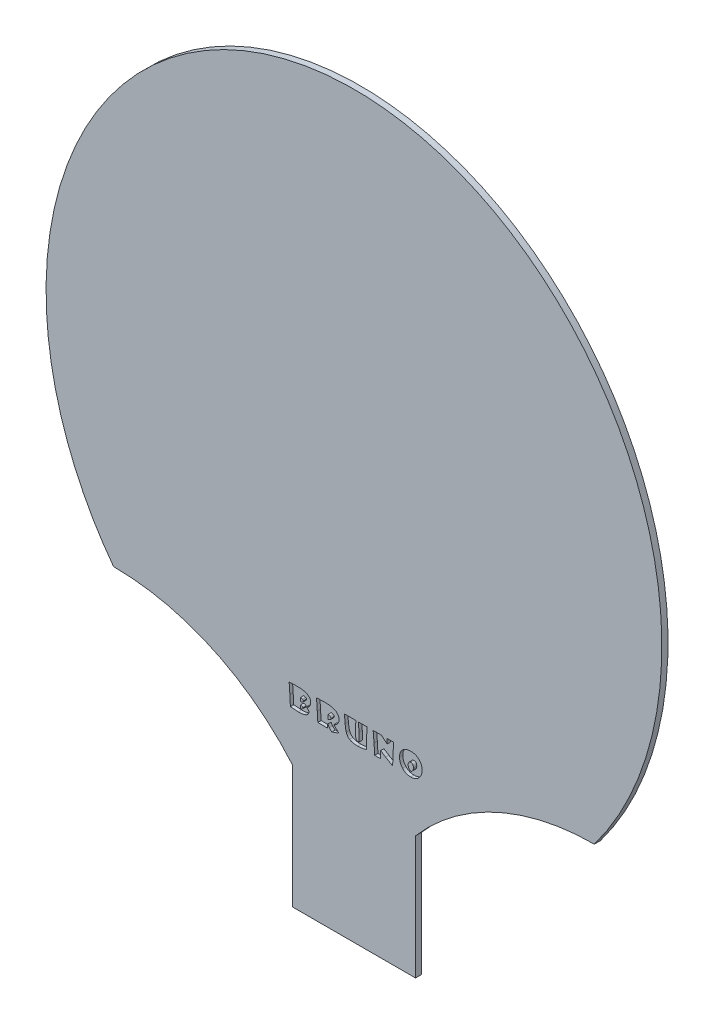
from build123d import *

# Parameters (mm, degrees)
ESBO_O1_W                = 30
ESBO_O1_H                = 30
RESSALTO_EXTRUS_O1_DEPTH = 1.5
CORTE_START              = -0.8
CORTE_BRUNO_1_DEPTH      = 0.8


# Read off the part's stored shape, not the designer's step: Corte Bruno 1
with BuildPart() as part:
    # Esboço1 → Ressalto-extrusão1 (new body)
    with BuildSketch(Plane.XY):
        with BuildLine():
            Line((-58.546856235, -50), (58.546856235, -50))
            add(Edge.make_bspline(
                [(58.546856235, -50), (156.12494996, 80), (0, 80), (-156.12494996, 80), (-58.546856235, -50)],
                knots=[4.037257447, 4.037257447, 4.037257447, 6.283185307, 6.283185307, 8.529113167, 8.529113167, 8.529113167], degree=2, weights=[1, 0.433012702, 1, 0.433012702, 1]))
        make_face()
        with Locations((0, -85)):
            Rectangle(ESBO_O1_W, ESBO_O1_H)
        with BuildLine():
            ThreePointArc((58.546856235, -50), (34.586844299, -55.23905744), (15, -70))
            Line((15, -70), (-15, -70))
            ThreePointArc((-15, -70), (-34.586844299, -55.23905744), (-58.546856235, -50))
            Line((-58.546856235, -50), (58.546856235, -50))
        make_face()
    extrude(amount=RESSALTO_EXTRUS_O1_DEPTH)

    # Corte Bruno 1 outline → Corte Bruno 1 (cut)
    # profile 1 of 5: a face of its own
    with BuildSketch(Plane.XY.offset(1.5).offset(CORTE_START)):
        with BuildLine():
            add(Edge.make_bspline(
                [(-13.84992284, -52.87654321), (-13.78208332, -52.876983521), (-13.648959534, -52.87784756), (-13.452157206, -52.882587587), (-13.262087736, -52.891023882), (-13.078202191, -52.903967336), (-12.900932607, -52.918842372), (-12.730237673, -52.938478289), (-12.565820729, -52.960369261), (-12.407843029, -52.98619911), (-12.256176636, -53.016508977), (-12.110880492, -53.048634563), (-11.972244267, -53.085496743), (-11.840218632, -53.126291311), (-11.713981082, -53.168847867), (-11.594979565, -53.216831681), (-11.481728101, -53.266662452), (-11.375132551, -53.32037367), (-11.275016955, -53.377692272), (-11.181296872, -53.438106746), (-11.094551522, -53.503233462), (-11.01304724, -53.570411353), (-10.93857607, -53.641989439), (-10.871080641, -53.717269742), (-10.809907242, -53.795946467), (-10.754869835, -53.877681226), (-10.706598948, -53.963297526), (-10.663401595, -54.051750881), (-10.629815113, -54.145080357), (-10.598619213, -54.240437599), (-10.577423487, -54.34014508), (-10.560554106, -54.442748054), (-10.550801475, -54.549128169), (-10.549860645, -54.621315776), (-10.549382716, -54.657986111)],
                knots=[0, 0, 0, 0, 0.048486167, 0.095146048, 0.140689849, 0.18445049, 0.226889914, 0.267820135, 0.307238957, 0.345430485, 0.382202775, 0.417768536, 0.451767723, 0.48469396, 0.516521869, 0.546945206, 0.576365371, 0.604933283, 0.632208699, 0.658786038, 0.684567735, 0.709692896, 0.734232273, 0.758314472, 0.781893727, 0.8054102, 0.828667038, 0.85210029, 0.875659383, 0.899496975, 0.923747408, 0.948415545, 0.97379579, 1, 1, 1, 1], degree=3))
            add(Edge.make_bspline(
                [(-15.796296296, -52.944058642), (-15.726536222, -52.938840423), (-15.583840166, -52.92816642), (-15.364950447, -52.913229121), (-15.135977451, -52.902200941), (-14.89743703, -52.892093831), (-14.649184653, -52.886174232), (-14.391362669, -52.879629247), (-14.123847283, -52.877181271), (-13.94219394, -52.87675814), (-13.84992284, -52.87654321)],
                knots=[0, 0, 0, 0, 0.107729629, 0.220363774, 0.337854188, 0.460740231, 0.588029638, 0.720256288, 0.857903743, 1, 1, 1, 1], degree=3))
            add(Edge.make_bspline(
                [(-15.608217593, -55.5), (-15.613561644, -55.420258829), (-15.624747537, -55.253348722), (-15.64482028, -54.991426575), (-15.664580635, -54.706517291), (-15.686565673, -54.398478921), (-15.712389704, -54.067756788), (-15.737571741, -53.713670399), (-15.767309339, -53.336657337), (-15.786444536, -53.07749066), (-15.796296296, -52.944058642)],
                knots=[0, 0, 0, 0, 0.093551319, 0.195816799, 0.307493408, 0.427857479, 0.55731239, 0.695802409, 0.843383806, 1, 1, 1, 1], degree=3))
            add(Edge.make_bspline(
                [(-15.485725309, -57.993248457), (-15.488569782, -57.921872956), (-15.494630749, -57.769786969), (-15.505343813, -57.527699133), (-15.517880709, -57.257958254), (-15.532359372, -56.960247124), (-15.549091142, -56.634919858), (-15.565853634, -56.281204636), (-15.586519195, -55.899939751), (-15.600821844, -55.63631669), (-15.608217593, -55.5)],
                knots=[0, 0, 0, 0, 0.085846366, 0.182920321, 0.291222691, 0.410368148, 0.541128977, 0.682714227, 0.835934891, 1, 1, 1, 1], degree=3))
            add(Edge.make_bspline(
                [(-13.54996142, -58.12345679), (-13.700460559, -58.122067851), (-14.009053283, -58.119219885), (-14.482443003, -58.091919335), (-14.977548228, -58.052503013), (-15.313828368, -58.013292015), (-15.485725309, -57.993248457)],
                knots=[0, 0, 0, 0, 0.23255558, 0.476846316, 0.732578565, 1, 1, 1, 1], degree=3))
            add(Edge.make_bspline(
                [(-11.871720679, -57.895833333), (-11.926499008, -57.914175772), (-12.039266979, -57.951935953), (-12.217295866, -57.997289844), (-12.407699068, -58.037261983), (-12.611287786, -58.068260587), (-12.827747527, -58.093689277), (-13.057212272, -58.110299303), (-13.299405775, -58.121200108), (-13.46507222, -58.122692218), (-13.54996142, -58.12345679)],
                knots=[0, 0, 0, 0, 0.101828071, 0.209625688, 0.323695004, 0.444761783, 0.572596546, 0.707900484, 0.850325188, 1, 1, 1, 1], degree=3))
            add(Edge.make_bspline(
                [(-10.981481481, -56.92650463), (-10.982367698, -56.953214497), (-10.984113749, -57.005839088), (-10.993645683, -57.083757453), (-11.010844066, -57.159174165), (-11.036526025, -57.231440793), (-11.067265469, -57.301899538), (-11.106111406, -57.369206466), (-11.151612857, -57.434090531), (-11.203989149, -57.495977139), (-11.263405735, -57.555276294), (-11.329840679, -57.611568618), (-11.402553825, -57.666327502), (-11.483097904, -57.716855342), (-11.569919916, -57.766570001), (-11.664319957, -57.812170147), (-11.765312974, -57.856075594), (-11.835583477, -57.882331177), (-11.871720679, -57.895833333)],
                knots=[0, 0, 0, 0, 0.056793551, 0.111896375, 0.166607851, 0.220860621, 0.27471153, 0.329814354, 0.385750141, 0.442982037, 0.501942653, 0.563991467, 0.62796407, 0.695270766, 0.765972385, 0.840554826, 0.918003967, 1, 1, 1, 1], degree=3))
            add(Edge.make_bspline(
                [(-11.599729938, -56.138503086), (-11.559235224, -56.150095557), (-11.477511736, -56.173490639), (-11.364152321, -56.239033627), (-11.259252588, -56.326298897), (-11.164994566, -56.432781743), (-11.085656904, -56.550650977), (-11.024827718, -56.673323417), (-10.988458924, -56.799377414), (-10.983787417, -56.884491082), (-10.981481481, -56.92650463)],
                knots=[0, 0, 0, 0, 0.11779373, 0.237722745, 0.363944042, 0.499365142, 0.635197097, 0.761457057, 0.882251166, 1, 1, 1, 1], degree=3))
            add(Edge.make_bspline(
                [(-10.915895062, -55.683256173), (-10.939932348, -55.711273333), (-10.987517431, -55.76673712), (-11.06488756, -55.842458313), (-11.144652973, -55.911896778), (-11.229727259, -55.971092723), (-11.315946641, -56.026170601), (-11.407374621, -56.071283359), (-11.501975636, -56.109110873), (-11.567096609, -56.128691081), (-11.599729938, -56.138503086)],
                knots=[0, 0, 0, 0, 0.132562368, 0.262425271, 0.388583219, 0.511977292, 0.63441079, 0.755799208, 0.877626448, 1, 1, 1, 1], degree=3))
            add(Edge.make_bspline(
                [(-10.549382716, -54.657986111), (-10.550444529, -54.70530682), (-10.552546547, -54.798985248), (-10.570798413, -54.936974393), (-10.598181098, -55.071517488), (-10.639488358, -55.201523284), (-10.690130605, -55.32892002), (-10.754764738, -55.451162127), (-10.82861733, -55.570862893), (-10.886573173, -55.645496446), (-10.915895062, -55.683256173)],
                knots=[0, 0, 0, 0, 0.127732324, 0.252865258, 0.375294402, 0.498043286, 0.620733818, 0.744996294, 0.870984699, 1, 1, 1, 1], degree=3))
        make_face()
        with BuildLine():
            add(Edge.make_bspline(
                [(-13.08121142, -57.140625), (-13.032953208, -57.141329709), (-12.942630318, -57.142648684), (-12.816042373, -57.129331333), (-12.707804238, -57.104839986), (-12.618191796, -57.065397394), (-12.548002597, -57.011342041), (-12.497848743, -56.943272615), (-12.467593365, -56.861670572), (-12.464557324, -56.80299619), (-12.462962963, -56.772183642)],
                knots=[0, 0, 0, 0, 0.17663686, 0.330603872, 0.465123508, 0.58158224, 0.686410906, 0.785800836, 0.887514417, 1, 1, 1, 1], degree=3))
            Line((-13.08121142, -57.140625), (-13.071618094, -56.456620844))
            add(Edge.make_bspline(
                [(-13.054205247, -56.456790123), (-13.058794525, -56.456630156), (-13.063383804, -56.456470189), (-13.071618094, -56.456620844)],
                knots=[0, 0, 0, 0, 0.369686737, 0.369686737, 0.369686737, 0.369686737], degree=3))
            add(Edge.make_bspline(
                [(-12.462962963, -56.772183642), (-12.464769003, -56.747157461), (-12.46824262, -56.699023752), (-12.49679066, -56.631602602), (-12.545610744, -56.576131374), (-12.6126373, -56.531499444), (-12.697641199, -56.497217469), (-12.800347161, -56.473030212), (-12.921366465, -56.459090332), (-13.007869363, -56.457592466), (-13.054205247, -56.456790123)],
                knots=[0, 0, 0, 0, 0.100094707, 0.192515572, 0.287595298, 0.392362388, 0.512546851, 0.653242547, 0.814256936, 1, 1, 1, 1], degree=3))
        make_face(mode=Mode.SUBTRACT)
        with BuildLine():
            add(Edge.make_bspline(
                [(-13.04841821, -55.659143519), (-12.993086587, -55.659576096), (-12.889230184, -55.660388036), (-12.744202583, -55.645597208), (-12.620743996, -55.617697242), (-12.518568652, -55.575664229), (-12.437395813, -55.518551853), (-12.380207906, -55.444897733), (-12.344110397, -55.357435895), (-12.341086167, -55.293963387), (-12.339506173, -55.260802469)],
                knots=[0, 0, 0, 0, 0.180384303, 0.338577899, 0.474404598, 0.591860886, 0.696948382, 0.794074037, 0.892414934, 1, 1, 1, 1], degree=3))
            Line((-13.04841821, -55.659143519), (-13.022376543, -54.84992284))
            add(Edge.make_bspline(
                [(-12.562307099, -54.954089506), (-12.598935587, -54.937457227), (-12.671629171, -54.904448494), (-12.785982743, -54.870741639), (-12.903410493, -54.851843062), (-12.982441671, -54.850567426), (-13.022376543, -54.84992284)],
                knots=[0, 0, 0, 0, 0.253208097, 0.50252152, 0.748621495, 1, 1, 1, 1], degree=3))
            add(Edge.make_bspline(
                [(-12.339506173, -55.260802469), (-12.340386558, -55.244686802), (-12.342110336, -55.213132642), (-12.351591741, -55.16699703), (-12.3692282, -55.123821467), (-12.394907931, -55.084393096), (-12.426373647, -55.046838519), (-12.46489794, -55.012281924), (-12.51110977, -54.981384649), (-12.544776449, -54.963435728), (-12.562307099, -54.954089506)],
                knots=[0, 0, 0, 0, 0.120452694, 0.23584402, 0.350004404, 0.466588951, 0.58588712, 0.715116267, 0.851657572, 1, 1, 1, 1], degree=3))
        make_face(mode=Mode.SUBTRACT)
    # profile 2 of 5: a face of its own
    with BuildSketch(Plane.XY.offset(1.5).offset(CORTE_START)):
        with BuildLine():
            add(Edge.make_bspline(
                [(15.787615741, -53.424382716), (15.820795875, -53.455176157), (15.886660933, -53.516303451), (15.978144747, -53.614464317), (16.064262288, -53.715467045), (16.14348088, -53.820802802), (16.215927143, -53.930186503), (16.282221866, -54.043044989), (16.343765584, -54.159087023), (16.397340682, -54.279477031), (16.444652606, -54.403539608), (16.486552905, -54.531145067), (16.520937903, -54.662956299), (16.548840604, -54.798555123), (16.570977024, -54.937593618), (16.587428087, -55.080119196), (16.597374785, -55.226579464), (16.598297183, -55.325408746), (16.598765432, -55.375578704)],
                knots=[0, 0, 0, 0, 0.06228022, 0.123630915, 0.184533228, 0.244884976, 0.304893523, 0.364993348, 0.424961101, 0.485565341, 0.546208333, 0.607633971, 0.670309008, 0.733568557, 0.798090541, 0.864005354, 0.930963318, 1, 1, 1, 1], degree=3))
            add(Edge.make_bspline(
                [(13.830632716, -52.75308642), (13.929407731, -52.755154433), (14.122633477, -52.759199923), (14.405102727, -52.789894245), (14.672441022, -52.843282551), (14.925550221, -52.916111963), (15.163792642, -53.011151618), (15.38811982, -53.126218868), (15.597827365, -53.262878798), (15.724392642, -53.370581855), (15.787615741, -53.424382716)],
                knots=[0, 0, 0, 0, 0.139929551, 0.273733109, 0.401924186, 0.525748481, 0.64636684, 0.764729608, 0.882475482, 1, 1, 1, 1], degree=3))
            add(Edge.make_bspline(
                [(11.893904321, -53.420524691), (11.957171583, -53.367093681), (12.083434764, -53.260460816), (12.291682911, -53.124446096), (12.513576323, -53.008910406), (12.750146369, -52.915706205), (13.000193712, -52.841879248), (13.264657694, -52.790355477), (13.543099634, -52.759113913), (13.733456233, -52.755123509), (13.830632716, -52.75308642)],
                knots=[0, 0, 0, 0, 0.118415536, 0.236323208, 0.355058288, 0.475863813, 0.59960796, 0.727643961, 0.860963044, 1, 1, 1, 1], degree=3))
            add(Edge.make_bspline(
                [(11.104938272, -55.375578704), (11.105396412, -55.324443308), (11.106302015, -55.223364194), (11.116426201, -55.074066533), (11.13179349, -54.928952233), (11.152666337, -54.787856897), (11.18086327, -54.651152795), (11.214368808, -54.518355678), (11.255156053, -54.39005304), (11.301503145, -54.265488459), (11.353169196, -54.144681038), (11.412526356, -54.028784623), (11.477230785, -53.916763517), (11.547326443, -53.808356849), (11.625080176, -53.705221822), (11.708118517, -53.605454854), (11.797485919, -53.509918139), (11.861710881, -53.450372548), (11.893904321, -53.420524691)],
                knots=[0, 0, 0, 0, 0.070527055, 0.139410522, 0.206311012, 0.271791149, 0.336066237, 0.398775425, 0.4606304, 0.521672383, 0.582060003, 0.64175974, 0.701168853, 0.760458663, 0.819708653, 0.879217002, 0.939456247, 1, 1, 1, 1], degree=3))
            add(Edge.make_bspline(
                [(11.825424383, -57.336419753), (11.767783615, -57.269013725), (11.653367568, -57.135213784), (11.507093572, -56.916844239), (11.382616989, -56.687961857), (11.281122311, -56.447551681), (11.201482999, -56.195770281), (11.14622429, -55.932105563), (11.111513926, -55.657497349), (11.107152898, -55.470526586), (11.104938272, -55.375578704)],
                knots=[0, 0, 0, 0, 0.124336901, 0.246806856, 0.367899504, 0.489368721, 0.612331856, 0.737771534, 0.866834594, 1, 1, 1, 1], degree=3))
            add(Edge.make_bspline(
                [(13.830632716, -58.185185185), (13.779812526, -58.184817923), (13.679020706, -58.18408953), (13.529762827, -58.172543289), (13.383890875, -58.156715771), (13.241923267, -58.133475135), (13.103486656, -58.10355166), (12.969026137, -58.066854144), (12.837656869, -58.024640016), (12.710871858, -57.97402647), (12.586483474, -57.918303338), (12.466624503, -57.854647976), (12.350135684, -57.784709938), (12.237355674, -57.708957539), (12.128918098, -57.625312803), (12.02416452, -57.535311493), (11.920923413, -57.440569921), (11.857409414, -57.371302269), (11.825424383, -57.336419753)],
                knots=[0, 0, 0, 0, 0.067845533, 0.134558231, 0.199795815, 0.263742144, 0.326561609, 0.388841816, 0.449801392, 0.510711057, 0.571043021, 0.631729859, 0.691810783, 0.752420123, 0.813044666, 0.874559574, 0.936829422, 1, 1, 1, 1], degree=3))
            add(Edge.make_bspline(
                [(15.84837963, -57.343171296), (15.815911097, -57.37756772), (15.751590546, -57.445707447), (15.649915481, -57.541805321), (15.543790328, -57.630052953), (15.434665882, -57.712621404), (15.321300796, -57.787762044), (15.204733154, -57.857492343), (15.083921441, -57.920209281), (14.959306292, -57.976243324), (14.831086121, -58.025352028), (14.698998822, -58.067815985), (14.563686092, -58.104811485), (14.424023757, -58.133147615), (14.281248552, -58.156807951), (14.134389019, -58.172517059), (13.983853127, -58.184119423), (13.882096468, -58.184827216), (13.830632716, -58.185185185)],
                knots=[0, 0, 0, 0, 0.06292556, 0.124656286, 0.185997485, 0.246482571, 0.306632448, 0.366861365, 0.427128246, 0.487629968, 0.548561133, 0.60970514, 0.672171037, 0.735090781, 0.799226004, 0.864650656, 0.93154664, 1, 1, 1, 1], degree=3))
            add(Edge.make_bspline(
                [(16.598765432, -55.375578704), (16.596733857, -55.469583451), (16.592732028, -55.654755561), (16.555331687, -55.926721216), (16.498257107, -56.18886564), (16.415753414, -56.440870584), (16.309046674, -56.682942696), (16.179168548, -56.915024024), (16.026858189, -57.137605588), (15.908278038, -57.274182288), (15.84837963, -57.343171296)],
                knots=[0, 0, 0, 0, 0.13070011, 0.257455244, 0.38115174, 0.503486546, 0.625637283, 0.74856821, 0.872994222, 1, 1, 1, 1], degree=3))
        make_face()
        with BuildLine():
            add(Edge.make_bspline(
                [(14.293595679, -56.613040123), (14.325405895, -56.560157307), (14.387392789, -56.457107345), (14.452030551, -56.291769463), (14.492918768, -56.124432494), (14.497649043, -56.011416234), (14.5, -55.955246914)],
                knots=[0, 0, 0, 0, 0.264506915, 0.515430717, 0.759168042, 1, 1, 1, 1], degree=3))
            add(Edge.make_bspline(
                [(13.802662037, -56.950617284), (13.825289821, -56.949888831), (13.870517805, -56.948432814), (13.936810107, -56.930265489), (14.002212351, -56.90507798), (14.064070079, -56.865729254), (14.125388374, -56.818561693), (14.184160257, -56.759887671), (14.241382286, -56.691144964), (14.275741257, -56.639748152), (14.293595679, -56.613040123)],
                knots=[0, 0, 0, 0, 0.108802247, 0.217471863, 0.329463808, 0.445658679, 0.56939707, 0.702050949, 0.845172658, 1, 1, 1, 1], degree=3))
            add(Edge.make_bspline(
                [(13.376350309, -56.621720679), (13.392712879, -56.647678208), (13.423892109, -56.697140839), (13.474363783, -56.764639245), (13.526157082, -56.821758623), (13.579234181, -56.86838166), (13.633142357, -56.905195805), (13.68831241, -56.931529759), (13.745135042, -56.948002341), (13.783588908, -56.949750297), (13.802662037, -56.950617284)],
                knots=[0, 0, 0, 0, 0.163512425, 0.311576446, 0.448640259, 0.573740312, 0.687336736, 0.795422133, 0.898529316, 1, 1, 1, 1], degree=3))
            add(Edge.make_bspline(
                [(13.203703704, -55.961998457), (13.205515346, -56.022298111), (13.209060592, -56.140299919), (13.243587235, -56.311660728), (13.296222138, -56.473812498), (13.349726426, -56.57257579), (13.376350309, -56.621720679)],
                knots=[0, 0, 0, 0, 0.26188506, 0.512489014, 0.757413178, 1, 1, 1, 1], degree=3))
            add(Edge.make_bspline(
                [(13.811342593, -55.098765432), (13.786858555, -55.099113841), (13.738928233, -55.099795892), (13.669894501, -55.111115461), (13.604839464, -55.126975418), (13.545479294, -55.151359956), (13.489970557, -55.181491621), (13.440312659, -55.219528967), (13.393781488, -55.262873251), (13.354971994, -55.31509796), (13.318355368, -55.372259929), (13.288105585, -55.437023998), (13.262169339, -55.508131737), (13.239456029, -55.585577724), (13.223787542, -55.670304659), (13.212495057, -55.7617925), (13.204203088, -55.859611198), (13.203873148, -55.927257731), (13.203703704, -55.961998457)],
                knots=[0, 0, 0, 0, 0.061107874, 0.1196257, 0.174382537, 0.228091982, 0.279517476, 0.331740119, 0.384018354, 0.437853843, 0.493805939, 0.553459928, 0.615993052, 0.682870666, 0.754879268, 0.831014146, 0.913215193, 1, 1, 1, 1], degree=3))
            add(Edge.make_bspline(
                [(14.5, -55.955246914), (14.499400876, -55.920510948), (14.49824545, -55.853521734), (14.490626717, -55.756200964), (14.477381848, -55.665582367), (14.458264877, -55.581721214), (14.433743939, -55.504784133), (14.405657268, -55.43358598), (14.369195228, -55.37041462), (14.330008563, -55.312003794), (14.283150878, -55.262098187), (14.23182394, -55.218215006), (14.174771351, -55.180978207), (14.112650205, -55.150413568), (14.044613869, -55.126768799), (13.971343015, -55.111259039), (13.893040859, -55.099743981), (13.839037596, -55.099097152), (13.811342593, -55.098765432)],
                knots=[0, 0, 0, 0, 0.082931877, 0.159936282, 0.232885765, 0.301408102, 0.365011769, 0.425593185, 0.483672034, 0.538821238, 0.59314157, 0.646509896, 0.699734505, 0.755346508, 0.811422744, 0.871201333, 0.933946964, 1, 1, 1, 1], degree=3))
        make_face(mode=Mode.SUBTRACT)
    # profile 3 of 5: a face of its own
    with BuildSketch(Plane.XY.offset(1.5).offset(CORTE_START)):
        with BuildLine():
            add(Edge.make_bspline(
                [(9.672839506, -52.938271605), (9.668038212, -53.00257345), (9.657739748, -53.140496731), (9.64078228, -53.36128478), (9.625114313, -53.61054493), (9.606685942, -53.887671956), (9.586158324, -54.193060389), (9.565060931, -54.526788627), (9.542923611, -54.888803498), (9.528116476, -55.139593369), (9.520447531, -55.269483025)],
                knots=[0, 0, 0, 0, 0.082801871, 0.177604637, 0.284350875, 0.403510097, 0.53425841, 0.677392921, 0.832914614, 1, 1, 1, 1], degree=3))
            Line((9.672839506, -52.938271605), (8.005208333, -52.938271605))
            add(Edge.make_bspline(
                [(8.052469136, -53.544945988), (8.049885443, -53.507009723), (8.044148414, -53.422773146), (8.034969961, -53.283799336), (8.020871626, -53.119577745), (8.010679921, -53.001606467), (8.005208333, -52.938271605)],
                knots=[0, 0, 0, 0, 0.18745622, 0.416242101, 0.686599767, 1, 1, 1, 1], degree=3))
            add(Edge.make_bspline(
                [(8.067901235, -54.111111111), (8.067738047, -54.057097024), (8.067425246, -53.953561506), (8.0644722, -53.805013899), (8.060025763, -53.670263868), (8.054891939, -53.585125357), (8.052469136, -53.544945988)],
                knots=[0, 0, 0, 0, 0.28605147, 0.54831042, 0.786834396, 1, 1, 1, 1], degree=3))
            Line((8.067901235, -54.111111111), (6.706018519, -52.938271605))
            Line((6.706018519, -52.938271605), (4.672839506, -52.938271605))
            add(Edge.make_bspline(
                [(4.887924383, -55.480709877), (4.878868397, -55.360793753), (4.861047952, -55.124821774), (4.835698579, -54.776853324), (4.808246656, -54.440940976), (4.781425581, -54.117172149), (4.754350603, -53.805319054), (4.727420632, -53.50567061), (4.700444507, -53.217920737), (4.681915418, -53.030214039), (4.672839506, -52.938271605)],
                knots=[0, 0, 0, 0, 0.141391042, 0.278230509, 0.410199938, 0.537648486, 0.660200676, 0.778234453, 0.891374872, 1, 1, 1, 1], degree=3))
            add(Edge.make_bspline(
                [(5.046103395, -58), (5.044541262, -57.969133334), (5.041253851, -57.904176377), (5.035168268, -57.802615499), (5.029716706, -57.692304442), (5.022818787, -57.57367729), (5.015198788, -57.446355979), (5.006175151, -57.310401808), (4.997840949, -57.165684761), (4.988154185, -57.012329977), (4.977259043, -56.850653497), (4.967017657, -56.680213322), (4.954991659, -56.501507484), (4.944127391, -56.3136627), (4.929879317, -56.117637688), (4.916891496, -55.912785046), (4.90199501, -55.699679201), (4.892676305, -55.554660051), (4.887924383, -55.480709877)],
                knots=[0, 0, 0, 0, 0.036730575, 0.077297186, 0.120915992, 0.167989387, 0.218518109, 0.272502756, 0.329919667, 0.390792372, 0.455121324, 0.522500778, 0.593717691, 0.667985261, 0.746115421, 0.827295416, 0.911932086, 1, 1, 1, 1], degree=3))
            Line((5.046103395, -58), (6.460069444, -58))
            Line((6.460069444, -58), (6.497685185, -56.271604938))
            add(Edge.make_bspline(
                [(7.705246914, -57.054783951), (7.665586407, -57.03182928), (7.58282949, -56.983931311), (7.45580197, -56.905090848), (7.318454072, -56.8195332), (7.172681741, -56.724843194), (7.01660588, -56.623635958), (6.852113149, -56.513334344), (6.677296546, -56.396163843), (6.558656988, -56.313888349), (6.497685185, -56.271604938)],
                knots=[0, 0, 0, 0, 0.095485285, 0.199242732, 0.311518653, 0.432683436, 0.561458902, 0.699146855, 0.845384129, 1, 1, 1, 1], degree=3))
            add(Edge.make_bspline(
                [(9.420138889, -58.061728395), (9.365691938, -58.032354449), (9.251439129, -57.970715444), (9.074634773, -57.869835625), (8.882192773, -57.759881154), (8.675080113, -57.63941562), (8.453236292, -57.508242447), (8.217262159, -57.366226766), (7.965739132, -57.214860555), (7.793895166, -57.109259709), (7.705246914, -57.054783951)],
                knots=[0, 0, 0, 0, 0.093312683, 0.195809609, 0.307027237, 0.427631593, 0.557209237, 0.695766304, 0.843056546, 1, 1, 1, 1], degree=3))
            add(Edge.make_bspline(
                [(9.520447531, -55.269483025), (9.515494982, -55.3704288), (9.505370258, -55.576796907), (9.492351409, -55.893191873), (9.478412803, -56.222702376), (9.466374358, -56.565134202), (9.453328774, -56.920687901), (9.442290323, -57.289479586), (9.430273013, -57.671402017), (9.423552995, -57.930230523), (9.420138889, -58.061728395)],
                knots=[0, 0, 0, 0, 0.108514277, 0.221840744, 0.339995699, 0.462621431, 0.589731775, 0.722005656, 0.85876492, 1, 1, 1, 1], degree=3))
        make_face()
    # profile 4 of 5: a face of its own
    with BuildSketch(Plane.XY.offset(1.5).offset(CORTE_START)):
        with BuildLine():
            add(Edge.make_bspline(
                [(3.091242284, -55.073688272), (3.090030598, -55.110020881), (3.087521147, -55.185267148), (3.082130432, -55.302248028), (3.078361284, -55.427324487), (3.07609134, -55.560457036), (3.071555835, -55.70156425), (3.068751222, -55.850749852), (3.067473041, -56.00798286), (3.06377513, -56.173214236), (3.062459027, -56.346838201), (3.059958923, -56.528800595), (3.059799781, -56.718819747), (3.057160109, -56.916532903), (3.056260106, -57.122298606), (3.056901759, -57.336099627), (3.055198445, -57.558254738), (3.055435006, -57.70904039), (3.055555556, -57.78587963)],
                knots=[0, 0, 0, 0, 0.040203956, 0.083263979, 0.129509243, 0.17858874, 0.23052064, 0.285643463, 0.343604843, 0.404415732, 0.468421297, 0.535626754, 0.605673868, 0.678568064, 0.754304142, 0.833239466, 0.915020079, 1, 1, 1, 1], degree=3))
            Line((3.091242284, -55.073688272), (3.179012346, -52.938271605))
            Line((3.179012346, -52.938271605), (1.080246914, -52.938271605))
            add(Edge.make_bspline(
                [(1.220100309, -55.020640432), (1.216618968, -54.956979881), (1.209303738, -54.823212013), (1.196633501, -54.612634278), (1.18215126, -54.382117579), (1.165789561, -54.131664113), (1.147298928, -53.861291972), (1.127468293, -53.57124215), (1.103605437, -53.261412996), (1.088195473, -53.048231833), (1.080246914, -52.938271605)],
                knots=[0, 0, 0, 0, 0.091642466, 0.192565366, 0.303231302, 0.423641177, 0.553334618, 0.692773308, 0.841530478, 1, 1, 1, 1], degree=3))
            add(Edge.make_bspline(
                [(1.265432099, -57.091435185), (1.265144958, -57.035172196), (1.264528003, -56.914285002), (1.262772409, -56.720087955), (1.258515045, -56.500189498), (1.253734723, -56.254240053), (1.248130174, -55.982236681), (1.240355098, -55.684523864), (1.230423017, -55.36111002), (1.223628958, -55.137024398), (1.220100309, -55.020640432)],
                knots=[0, 0, 0, 0, 0.081488378, 0.175086705, 0.281269023, 0.400030115, 0.531370389, 0.675301446, 0.831360419, 1, 1, 1, 1], degree=3))
            add(Edge.make_bspline(
                [(1.036844136, -57.135802469), (1.076093752, -57.133734086), (1.154362677, -57.129609457), (1.228481657, -57.104134956), (1.265432099, -57.091435185)],
                knots=[0, 0, 0, 0, 0.501471251, 1, 1, 1, 1], degree=3))
            add(Edge.make_bspline(
                [(0.533371914, -56.890817901), (0.545208579, -56.91062796), (0.568516859, -56.94963712), (0.615548106, -56.998890992), (0.667378695, -57.042155911), (0.727839303, -57.075954358), (0.794799502, -57.103245957), (0.869467819, -57.122043556), (0.950950107, -57.133811323), (1.007544257, -57.135123256), (1.036844136, -57.135802469)],
                knots=[0, 0, 0, 0, 0.117148244, 0.23068355, 0.344713463, 0.459842654, 0.581744188, 0.711978657, 0.850885821, 1, 1, 1, 1], degree=3))
            add(Edge.make_bspline(
                [(0.400270062, -55.908950617), (0.400781608, -55.969084929), (0.401755919, -56.083619077), (0.410202124, -56.247265631), (0.419947534, -56.394355474), (0.434541825, -56.525286267), (0.451765537, -56.640230644), (0.475385416, -56.738542257), (0.499713314, -56.821733466), (0.522831819, -56.869184306), (0.533371914, -56.890817901)],
                knots=[0, 0, 0, 0, 0.180760737, 0.344283932, 0.492541742, 0.623823626, 0.74029517, 0.841571461, 0.927769902, 1, 1, 1, 1], degree=3))
            add(Edge.make_bspline(
                [(0.391589506, -54.391782407), (0.390445864, -54.438397906), (0.388040516, -54.536441196), (0.387996435, -54.690459962), (0.386128045, -54.858924154), (0.388076373, -55.041537109), (0.3881927, -55.238307199), (0.391683415, -55.449207317), (0.395350541, -55.674261594), (0.398598742, -55.829219188), (0.400270062, -55.908950617)],
                knots=[0, 0, 0, 0, 0.092191639, 0.193900564, 0.304508687, 0.425287349, 0.554965254, 0.69355408, 0.842322208, 1, 1, 1, 1], degree=3))
            add(Edge.make_bspline(
                [(0.462962963, -52.938271605), (0.459916819, -52.981665273), (0.453488768, -53.07323571), (0.446544046, -53.218316864), (0.437347494, -53.377736633), (0.429199658, -53.552034773), (0.418758117, -53.74100962), (0.410996496, -53.944914146), (0.400761302, -54.163495483), (0.394715543, -54.313975029), (0.391589506, -54.391782407)],
                knots=[0, 0, 0, 0, 0.089670421, 0.189224836, 0.299403609, 0.418848389, 0.548917169, 0.689547611, 0.839476613, 1, 1, 1, 1], degree=3))
            Line((0.462962963, -52.938271605), (-2.314814815, -52.938271605))
            add(Edge.make_bspline(
                [(-2.159529321, -54.953125), (-2.179221551, -54.778945177), (-2.218096081, -54.435095917), (-2.263123907, -53.924752793), (-2.296849466, -53.427292369), (-2.308884125, -53.0997063), (-2.314814815, -52.938271605)],
                knots=[0, 0, 0, 0, 0.260134774, 0.513533358, 0.760268823, 1, 1, 1, 1], degree=3))
            add(Edge.make_bspline(
                [(-1.880787037, -56.550347222), (-1.893432319, -56.509958477), (-1.92082904, -56.422453972), (-1.95545309, -56.277906321), (-1.990820833, -56.111586018), (-2.026701269, -55.922897619), (-2.060959797, -55.712184574), (-2.094440514, -55.478983991), (-2.128437985, -55.223759367), (-2.148887903, -55.045753164), (-2.159529321, -54.953125)],
                knots=[0, 0, 0, 0, 0.07818343, 0.169388834, 0.274487952, 0.392399358, 0.524247725, 0.668921594, 0.827718448, 1, 1, 1, 1], degree=3))
            add(Edge.make_bspline(
                [(-1.059992284, -57.694251543), (-1.107306906, -57.662391367), (-1.201749106, -57.598796965), (-1.331062, -57.486553053), (-1.450647003, -57.362635439), (-1.55865688, -57.224958691), (-1.656295647, -57.074802683), (-1.743259812, -56.912274502), (-1.818884567, -56.73654772), (-1.859834131, -56.613372843), (-1.880787037, -56.550347222)],
                knots=[0, 0, 0, 0, 0.118866889, 0.237263871, 0.356289501, 0.47755091, 0.601594317, 0.729383016, 0.861531802, 1, 1, 1, 1], degree=3))
            add(Edge.make_bspline(
                [(0.908564815, -58.12345679), (0.804043967, -58.122232803), (0.601224892, -58.119857698), (0.306619105, -58.099527086), (0.031388182, -58.065857387), (-0.225118179, -58.020764366), (-0.462112261, -57.959445418), (-0.680773518, -57.887240119), (-0.880061356, -57.800013036), (-1.001130384, -57.728849944), (-1.059992284, -57.694251543)],
                knots=[0, 0, 0, 0, 0.153687137, 0.29822455, 0.433977344, 0.561301056, 0.680898824, 0.793625401, 0.899663844, 1, 1, 1, 1], degree=3))
            add(Edge.make_bspline(
                [(3.055555556, -57.78587963), (2.965405423, -57.812927637), (2.786293457, -57.866667122), (2.51590382, -57.93468659), (2.246396027, -57.993049009), (1.977293695, -58.039749038), (1.709167203, -58.078311655), (1.441648767, -58.103371168), (1.175011548, -58.121224679), (0.997329183, -58.122713182), (0.908564815, -58.12345679)],
                knots=[0, 0, 0, 0, 0.129417111, 0.257128331, 0.38329971, 0.508538878, 0.632651568, 0.755698968, 0.8779551, 1, 1, 1, 1], degree=3))
        make_face()
    # profile 5 of 5: a face of its own
    with BuildSketch(Plane.XY.offset(1.5).offset(CORTE_START)):
        with BuildLine():
            add(Edge.make_bspline(
                [(-7.071566358, -52.87654321), (-7.000832096, -52.876904209), (-6.861589874, -52.877614847), (-6.656104777, -52.883503468), (-6.457382167, -52.893162286), (-6.265315578, -52.906142332), (-6.080201015, -52.925098621), (-5.901618975, -52.94578874), (-5.7298997, -52.97103769), (-5.564706605, -52.999390334), (-5.406743232, -53.03387446), (-5.25481948, -53.069570031), (-5.110191392, -53.112034111), (-4.971206845, -53.155144631), (-4.840135561, -53.205232822), (-4.715027842, -53.256657718), (-4.597400175, -53.313800357), (-4.486549746, -53.374647654), (-4.381500558, -53.438362937), (-4.283442043, -53.506479576), (-4.192363131, -53.579105241), (-4.108265113, -53.655755015), (-4.029892088, -53.735296261), (-3.959262003, -53.819710399), (-3.895578921, -53.907970635), (-3.837272177, -53.999250105), (-3.787109557, -54.095293397), (-3.743946699, -54.19510493), (-3.705427995, -54.298398218), (-3.676676314, -54.406545044), (-3.651516379, -54.517661332), (-3.636106576, -54.633231365), (-3.624525253, -54.752271992), (-3.623815342, -54.833174419), (-3.62345679, -54.874035494)],
                knots=[0, 0, 0, 0, 0.04735022, 0.093210132, 0.137597532, 0.180532045, 0.222056002, 0.262152129, 0.300867697, 0.338232286, 0.374323107, 0.409088199, 0.442671389, 0.47520584, 0.506466038, 0.536563682, 0.56572968, 0.593950514, 0.621190861, 0.647937876, 0.673818846, 0.699110557, 0.724070439, 0.748512767, 0.772706527, 0.796888797, 0.820955867, 0.845146756, 0.86965721, 0.894668073, 0.919996386, 0.94586751, 0.972659514, 1, 1, 1, 1], degree=3))
            add(Edge.make_bspline(
                [(-9.117283951, -52.943094136), (-9.02148158, -52.937851253), (-8.833115677, -52.927542737), (-8.555012067, -52.914020191), (-8.285908427, -52.902543411), (-8.025831751, -52.892398966), (-7.774694324, -52.886395197), (-7.532629827, -52.879824761), (-7.299195857, -52.877213393), (-7.146476594, -52.876763759), (-7.071566358, -52.87654321)],
                knots=[0, 0, 0, 0, 0.140609385, 0.276465119, 0.408041671, 0.535343427, 0.6578907, 0.776186883, 0.890217559, 1, 1, 1, 1], degree=3))
            add(Edge.make_bspline(
                [(-8.941743827, -55.630208333), (-8.945586454, -55.547260303), (-8.953659512, -55.372992986), (-8.966673036, -55.099009782), (-8.984613499, -54.800378904), (-9.004407985, -54.476893608), (-9.029374165, -54.128806014), (-9.054646242, -53.755441257), (-9.085001578, -53.35747488), (-9.106313771, -53.083908789), (-9.117283951, -52.943094136)],
                knots=[0, 0, 0, 0, 0.092503851, 0.194343347, 0.305558362, 0.425775752, 0.555379325, 0.69432218, 0.842656245, 1, 1, 1, 1], degree=3))
            add(Edge.make_bspline(
                [(-8.804783951, -58), (-8.809332272, -57.932166149), (-8.81900983, -57.787834675), (-8.833376273, -57.558274557), (-8.848849304, -57.302039253), (-8.86522812, -57.019115488), (-8.882172161, -56.709467348), (-8.902238672, -56.37357667), (-8.920742621, -56.010843662), (-8.934577721, -55.760090078), (-8.941743827, -55.630208333)],
                knots=[0, 0, 0, 0, 0.085921888, 0.182817761, 0.290688465, 0.410345886, 0.540979288, 0.682611739, 0.835603782, 1, 1, 1, 1], degree=3))
            Line((-8.804783951, -58), (-6.404128086, -58))
            Line((-6.404128086, -58), (-6.384926587, -57.115194683))
            add(Edge.make_bspline(
                [(-6.015432099, -57.701967593), (-6.031991809, -57.678931846), (-6.067238877, -57.629900644), (-6.119491426, -57.549918474), (-6.176631446, -57.46080588), (-6.238358464, -57.362614754), (-6.304140287, -57.254367075), (-6.352928554, -57.170530307), (-6.380399501, -57.123030436), (-6.384926587, -57.115194683)],
                knots=[0, 0, 0, 0, 0.087631971, 0.186523189, 0.295072319, 0.414668489, 0.544803191, 0.68635659, 0.714312377, 0.714312377, 0.714312377, 0.714312377], degree=3))
            add(Edge.make_bspline(
                [(-5.386574074, -58.308641975), (-5.40278735, -58.295947338), (-5.438556809, -58.267940641), (-5.494295139, -58.217700545), (-5.559921047, -58.158294982), (-5.634020261, -58.087676192), (-5.716948668, -58.006628611), (-5.808829884, -57.914599228), (-5.909473553, -57.812045714), (-5.979165304, -57.739644408), (-6.015432099, -57.701967593)],
                knots=[0, 0, 0, 0, 0.070633393, 0.155830208, 0.257340146, 0.374384039, 0.506995822, 0.655198735, 0.820569345, 1, 1, 1, 1], degree=3))
            add(Edge.make_bspline(
                [(-4.546489198, -57.990354938), (-4.686332524, -58.043429354), (-4.966300259, -58.149684865), (-5.246389067, -58.255620819), (-5.386574074, -58.308641975)],
                knots=[0, 0, 0, 0, 0.499498007, 1, 1, 1, 1], degree=3))
            add(Edge.make_bspline(
                [(-3.685185185, -57.681712963), (-3.707383271, -57.689387947), (-3.755723517, -57.706101579), (-3.834102536, -57.734268108), (-3.923851135, -57.767177101), (-4.026288909, -57.802371363), (-4.139158042, -57.844612636), (-4.265030054, -57.88826525), (-4.401902564, -57.937704037), (-4.496986078, -57.972328487), (-4.546489198, -57.990354938)],
                knots=[0, 0, 0, 0, 0.077012147, 0.167707528, 0.273082348, 0.390441341, 0.522835182, 0.66820365, 0.8272576, 1, 1, 1, 1], degree=3))
            add(Edge.make_bspline(
                [(-4.356481481, -57.050925926), (-4.337674453, -57.070699172), (-4.297866819, -57.112551935), (-4.231427617, -57.175352614), (-4.159930468, -57.246322113), (-4.078991901, -57.32127681), (-3.99169935, -57.403448938), (-3.896085356, -57.490735328), (-3.793832292, -57.584984999), (-3.722257272, -57.648707873), (-3.685185185, -57.681712963)],
                knots=[0, 0, 0, 0, 0.08884051, 0.188043018, 0.297607767, 0.416843024, 0.547200029, 0.687969253, 0.838384522, 1, 1, 1, 1], degree=3))
            add(Edge.make_bspline(
                [(-4.921682099, -56.512731481), (-4.911723782, -56.522063844), (-4.887656902, -56.544617942), (-4.845582783, -56.583544008), (-4.792280107, -56.634432239), (-4.726666942, -56.695455249), (-4.65091238, -56.769236932), (-4.562670511, -56.852977331), (-4.463726505, -56.948559625), (-4.393491467, -57.015599576), (-4.356481481, -57.050925926)],
                knots=[0, 0, 0, 0, 0.052460265, 0.126783968, 0.220322919, 0.335724386, 0.471196877, 0.626781875, 0.803334667, 1, 1, 1, 1], degree=3))
            add(Edge.make_bspline(
                [(-4.060378086, -55.960069444), (-4.090524966, -55.992287592), (-4.150527476, -56.056412628), (-4.246761526, -56.144898496), (-4.347978424, -56.225282055), (-4.452710535, -56.299109732), (-4.563571652, -56.363505186), (-4.678322315, -56.421666328), (-4.797893888, -56.472053059), (-4.880328773, -56.499142239), (-4.921682099, -56.512731481)],
                knots=[0, 0, 0, 0, 0.127713105, 0.254192369, 0.378044761, 0.501729152, 0.624809652, 0.748857759, 0.874014904, 1, 1, 1, 1], degree=3))
            add(Edge.make_bspline(
                [(-3.62345679, -54.874035494), (-3.6247509, -54.923290021), (-3.627316414, -55.020934818), (-3.648013407, -55.165796979), (-3.683229854, -55.306648736), (-3.730362847, -55.444901127), (-3.792844481, -55.57922916), (-3.868233848, -55.710619935), (-3.957327183, -55.838777758), (-4.025606649, -55.919143202), (-4.060378086, -55.960069444)],
                knots=[0, 0, 0, 0, 0.12332821, 0.244492413, 0.36557632, 0.486534322, 0.609754708, 0.735997873, 0.865556455, 1, 1, 1, 1], degree=3))
        make_face()
        with BuildLine():
            add(Edge.make_bspline(
                [(-5.908371914, -55.971643519), (-5.883974767, -55.959951834), (-5.837121371, -55.937498589), (-5.773626387, -55.896433597), (-5.71927257, -55.851583265), (-5.675161846, -55.801684576), (-5.64075105, -55.748059387), (-5.616418166, -55.6903433), (-5.6013033, -55.628406649), (-5.599625783, -55.585607754), (-5.598765432, -55.563657407)],
                knots=[0, 0, 0, 0, 0.148860847, 0.285879172, 0.415321212, 0.535742789, 0.651166747, 0.764618437, 0.879279432, 1, 1, 1, 1], degree=3))
            add(Edge.make_bspline(
                [(-6.354938272, -56.086419753), (-6.320737174, -56.085190765), (-6.249725136, -56.082639005), (-6.141058688, -56.057969504), (-6.0255327, -56.022783612), (-5.948574698, -55.989191832), (-5.908371914, -55.971643519)],
                knots=[0, 0, 0, 0, 0.220626717, 0.45808917, 0.716906319, 1, 1, 1, 1], degree=3))
            Line((-6.354938272, -56.086419753), (-6.342399691, -55.093942901))
            add(Edge.make_bspline(
                [(-5.886188272, -55.179783951), (-5.923854597, -55.165420729), (-5.998354511, -55.137011832), (-6.113372554, -55.109894433), (-6.228071453, -55.092929806), (-6.30440434, -55.093606214), (-6.342399691, -55.093942901)],
                knots=[0, 0, 0, 0, 0.258340963, 0.510970464, 0.756581343, 1, 1, 1, 1], degree=3))
            add(Edge.make_bspline(
                [(-5.598765432, -55.563657407), (-5.599675934, -55.542037143), (-5.601434594, -55.500276993), (-5.615522395, -55.440050856), (-5.637973955, -55.384446255), (-5.66872516, -55.332629995), (-5.710357134, -55.286592444), (-5.761311128, -55.246680809), (-5.819566351, -55.20891847), (-5.86335472, -55.189769321), (-5.886188272, -55.179783951)],
                knots=[0, 0, 0, 0, 0.126424675, 0.244192826, 0.359852521, 0.47635106, 0.594958068, 0.720736928, 0.854377586, 1, 1, 1, 1], degree=3))
        make_face(mode=Mode.SUBTRACT)
    extrude(amount=CORTE_BRUNO_1_DEPTH, mode=Mode.SUBTRACT)


solid = part.part
